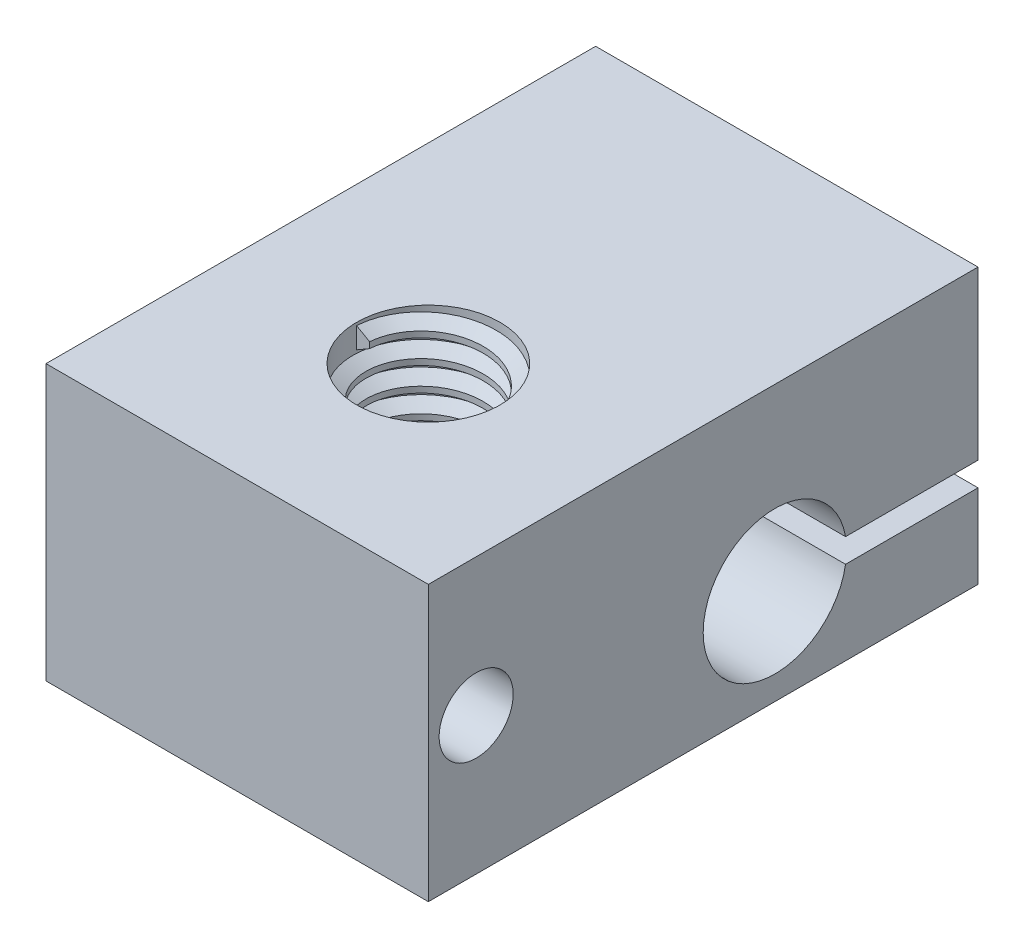
from build123d import *
from build123d.topology import SkipClean

# Parameters (mm, degrees)
CROQUIS1_W              = 16
CROQUIS1_H              = 23
SALIENTE_EXTRUIR1_DEPTH = 11.5
CROQUIS2_R              = 3
CROQUIS2_R_2            = 1.5
CORTAR_EXTRUIR1_DEPTH   = 11.5
SALIENTE_EXTRUIR2_START = -6
CROQUIS3_R              = 1.5
SALIENTE_EXTRUIR2_DEPTH = 6
CROQUIS4_R              = 1.55
CORTAR_EXTRUIR2_DEPTH   = 3.5
CROQUIS5_R              = 3
CORTAR_EXTRUIR3_DEPTH   = 23.5
ROSCA1_PITCH            = 1
ROSCA2_PITCH            = 0.5
ROSCA3_PITCH            = 0.5
CROQUIS13_R             = 1.55
CORTAR_EXTRUIR4_DEPTH   = 21.51219167
CROQUIS14_W             = 5.541960108
CROQUIS14_H             = 1
CORTAR_EXTRUIR5_DEPTH   = 23.814469264


with BuildPart() as part:
    # Croquis1 → Saliente-Extruir1 (new body)
    with BuildSketch(Plane(origin=(0, 0, 0), x_dir=(1, 0, 0), z_dir=(0, 1, 0))):
        Rectangle(CROQUIS1_W, CROQUIS1_H)
    extrude(amount=SALIENTE_EXTRUIR1_DEPTH)

    # Croquis2 → Cortar-Extruir1 (cut)
    with BuildSketch(Plane.XZ):
        with Locations(Location((0, 3.5, 0), (0, 0, 270))):
            Circle(CROQUIS2_R)
        with Locations(Location((0, 9.5, 0), (0, 0, 270))):
            Circle(CROQUIS2_R_2)
        with Locations(Location((0, -9, 0), (0, 0, 270))):
            Circle(CROQUIS2_R_2)
    extrude(amount=-CORTAR_EXTRUIR1_DEPTH, mode=Mode.SUBTRACT)

    # Croquis3 → Saliente-Extruir2 (add)
    with BuildSketch(Plane(origin=(0, 11.5, 0), x_dir=(1, 0, 0), z_dir=(0, 1, 0)).offset(SALIENTE_EXTRUIR2_START)):
        with Locations(Location((0, 9, 0), (0, 0, 90))):
            Circle(CROQUIS3_R)
        with Locations(Location((0, -9.5, 0), (0, 0, 90))):
            Circle(CROQUIS3_R)
    extrude(amount=SALIENTE_EXTRUIR2_DEPTH)

    # Croquis4 → Cortar-Extruir2 (cut)
    with BuildSketch(Plane.ZY.offset(8)):
        with Locations((9.5, 5.75)):
            Circle(CROQUIS4_R)
    extrude(amount=-CORTAR_EXTRUIR2_DEPTH, mode=Mode.SUBTRACT)

    # Croquis5 → Cortar-Extruir3 (cut)
    with BuildSketch(Plane.ZY.offset(8)):
        with BuildLine():
            Line((-11.5, 4.5), (-11.5, 3.5))
            Line((-11.5, 3.5), (-5.958039892, 3.5))
            ThreePointArc((-5.958039892, 3.5), (-6, 4), (-5.958039892, 4.5))
            Line((-5.958039892, 4.5), (-11.5, 4.5))
        make_face()
        with Locations((-3, 4)):
            Circle(CROQUIS5_R)
    extrude(amount=-CORTAR_EXTRUIR3_DEPTH, mode=Mode.SUBTRACT)

    # Rosca1: the profile of Perfil de rosca1 profile screwed along a right-hand helix of 10.5 turns, 8 arcs to a turn; built about Z, then put on its axis
    rosca1_z = Axis((0, 0, 0), (0, 0, 1))
    rosca1_corners = [(3.0003, 0, -0.000173205), (3.0003, 0, 0.875173202), (2.458734125, 0, 0.562499999), (2.458734125, 0, 0.312499999)]
    with BuildLine(mode=Mode.PRIVATE) as rosca1_profile:
        Line(rosca1_corners[0], rosca1_corners[1])
        Line(rosca1_corners[1], rosca1_corners[2])
        Line(rosca1_corners[2], rosca1_corners[3])
        Line(rosca1_corners[3], rosca1_corners[0])
    rosca1_cap = Face(rosca1_profile.wire())
    rosca1_turn_angles = [0, 22.5, 45, 67.5, 90, 112.5, 135, 157.5, 180, 202.5, 225, 247.5, 270, 292.5, 315, 337.5, 360]
    rosca1_turn_weights = [1, 0.9238795325112867, 1, 0.9238795325112867, 1, 0.9238795325112867, 1, 0.9238795325112867, 1, 0.9238795325112867, 1, 0.9238795325112867, 1, 0.9238795325112867, 1, 0.9238795325112867, 1]
    rosca1_turn_rails = [Edge.make_bspline([Vector(p[0], p[1], 0).rotate(rosca1_z, rosca1_turn_angles[k]) / rosca1_turn_weights[k] + Vector(0, 0, p[2] + ROSCA1_PITCH * rosca1_turn_angles[k] / 360) for k in range(17)], [0, 0, 0, 1, 1, 2, 2, 3, 3, 4, 4, 5, 5, 6, 6, 7, 7, 8, 8, 8], 2, rosca1_turn_weights) for p in rosca1_corners]
    rosca1_turn_sides = [Face.make_surface_from_curves(rosca1_turn_rails[p[0]], rosca1_turn_rails[p[1]]) for p in [(0, 1), (1, 2), (2, 3), (3, 0)]]
    rosca1_last_angles = [3600, 3622.5, 3645, 3667.5, 3690, 3712.5, 3735, 3757.5, 3780]
    rosca1_last_weights = [1, 0.9238795325112867, 1, 0.9238795325112867, 1, 0.9238795325112867, 1, 0.9238795325112867, 1]
    rosca1_last_rails = [Edge.make_bspline([Vector(p[0], p[1], 0).rotate(rosca1_z, rosca1_last_angles[k]) / rosca1_last_weights[k] + Vector(0, 0, p[2] + ROSCA1_PITCH * rosca1_last_angles[k] / 360) for k in range(9)], [0, 0, 0, 1, 1, 2, 2, 3, 3, 4, 4, 4], 2, rosca1_last_weights) for p in rosca1_corners]
    rosca1_last_sides = [Face.make_surface_from_curves(rosca1_last_rails[p[0]], rosca1_last_rails[p[1]]) for p in [(0, 1), (1, 2), (2, 3), (3, 0)]]
    rosca1 = Plane(origin=(0, 0, 3.5), x_dir=(1, 0, 0), z_dir=(0, 1, 0)) * Solid(Shell([*[p.moved(Location((0, 0, ROSCA1_PITCH * i))) for i in range(10) for p in rosca1_turn_sides], *rosca1_last_sides, rosca1_cap, rosca1_cap.rotate(rosca1_z, 3780).moved(Location((0, 0, ROSCA1_PITCH * 3780 / 360)))]))
    add(rosca1)

    # Rosca2: the profile of Perfil de rosca2 profile screwed along a right-hand helix of 11 turns, 6 arcs to a turn; built about Z, then put on its axis
    with SkipClean():  # the faces are left unmerged after this step: merging them gives an invalid solid
        rosca2_z = Axis((0, 0, 0), (0, 0, 1))
        rosca2_corners = [(1.5003, 0, -0.000173205), (1.5003, 0, 0.437673204), (1.229367063, 0, 0.281249999), (1.229367063, 0, 0.156249999)]
        with BuildLine(mode=Mode.PRIVATE) as rosca2_profile:
            Line(rosca2_corners[0], rosca2_corners[1])
            Line(rosca2_corners[1], rosca2_corners[2])
            Line(rosca2_corners[2], rosca2_corners[3])
            Line(rosca2_corners[3], rosca2_corners[0])
        rosca2_cap = Face(rosca2_profile.wire())
        rosca2_turn_angles = [0, 30, 60, 90, 120, 150, 180, 210, 240, 270, 300, 330, 360]
        rosca2_turn_weights = [1, 0.8660254037844387, 1, 0.8660254037844387, 1, 0.8660254037844387, 1, 0.8660254037844387, 1, 0.8660254037844387, 1, 0.8660254037844387, 1]
        rosca2_turn_rails = [Edge.make_bspline([Vector(p[0], p[1], 0).rotate(rosca2_z, rosca2_turn_angles[k]) / rosca2_turn_weights[k] + Vector(0, 0, p[2] + ROSCA2_PITCH * rosca2_turn_angles[k] / 360) for k in range(13)], [0, 0, 0, 1, 1, 2, 2, 3, 3, 4, 4, 5, 5, 6, 6, 6], 2, rosca2_turn_weights) for p in rosca2_corners]
        rosca2_turn_sides = [Face.make_surface_from_curves(rosca2_turn_rails[p[0]], rosca2_turn_rails[p[1]]) for p in [(0, 1), (1, 2), (2, 3), (3, 0)]]
        rosca2 = Plane(origin=(0, 0, -9), x_dir=(1, 0, 0), z_dir=(0, 1, 0)) * Solid(Shell([*[p.moved(Location((0, 0, ROSCA2_PITCH * i))) for i in range(11) for p in rosca2_turn_sides], rosca2_cap, rosca2_cap.rotate(rosca2_z, 3960).moved(Location((0, 0, ROSCA2_PITCH * 3960 / 360)))]))
        add(rosca2)

    # Rosca3: the profile of Perfil de rosca3 profile screwed along a right-hand helix of 11 turns, 6 arcs to a turn; built about Z, then put on its axis
    with SkipClean():  # the faces are left unmerged after this step: merging them gives an invalid solid
        rosca3_z = Axis((0, 0, 0), (0, 0, 1))
        rosca3_corners = [(1.5003, 0, -0.000173205), (1.5003, 0, 0.437673204), (1.229367063, 0, 0.281249999), (1.229367062, 0, 0.156249999)]
        with BuildLine(mode=Mode.PRIVATE) as rosca3_profile:
            Line(rosca3_corners[0], rosca3_corners[1])
            Line(rosca3_corners[1], rosca3_corners[2])
            Line(rosca3_corners[2], rosca3_corners[3])
            Line(rosca3_corners[3], rosca3_corners[0])
        rosca3_cap = Face(rosca3_profile.wire())
        rosca3_turn_angles = [0, 30, 60, 90, 120, 150, 180, 210, 240, 270, 300, 330, 360]
        rosca3_turn_weights = [1, 0.8660254037844387, 1, 0.8660254037844387, 1, 0.8660254037844387, 1, 0.8660254037844387, 1, 0.8660254037844387, 1, 0.8660254037844387, 1]
        rosca3_turn_rails = [Edge.make_bspline([Vector(p[0], p[1], 0).rotate(rosca3_z, rosca3_turn_angles[k]) / rosca3_turn_weights[k] + Vector(0, 0, p[2] + ROSCA3_PITCH * rosca3_turn_angles[k] / 360) for k in range(13)], [0, 0, 0, 1, 1, 2, 2, 3, 3, 4, 4, 5, 5, 6, 6, 6], 2, rosca3_turn_weights) for p in rosca3_corners]
        rosca3_turn_sides = [Face.make_surface_from_curves(rosca3_turn_rails[p[0]], rosca3_turn_rails[p[1]]) for p in [(0, 1), (1, 2), (2, 3), (3, 0)]]
        rosca3 = Plane(origin=(0, 0, 9.5), x_dir=(1, 0, 0), z_dir=(0, 1, 0)) * Solid(Shell([*[p.moved(Location((0, 0, ROSCA3_PITCH * i))) for i in range(11) for p in rosca3_turn_sides], rosca3_cap, rosca3_cap.rotate(rosca3_z, 3960).moved(Location((0, 0, ROSCA3_PITCH * 3960 / 360)))]))
        add(rosca3)

    # Croquis13 → Cortar-Extruir4 (cut, through all)
    with SkipClean():  # the faces are left unmerged after this step: merging them gives an invalid solid
        with BuildSketch(Plane.ZY.offset(4.5)):
            with Locations((9.5, 5.75)):
                Circle(CROQUIS13_R)
        extrude(amount=-CORTAR_EXTRUIR4_DEPTH, mode=Mode.SUBTRACT)

    # Croquis14 → Cortar-Extruir5 (cut, through all)
    with SkipClean():  # the faces are left unmerged after this step: merging them gives an invalid solid
        with BuildSketch(Plane.ZY.offset(8)):
            with Locations((-8.729019946, 4)):
                Rectangle(CROQUIS14_W, CROQUIS14_H)
        extrude(amount=-CORTAR_EXTRUIR5_DEPTH, mode=Mode.SUBTRACT)


solid = part.part
